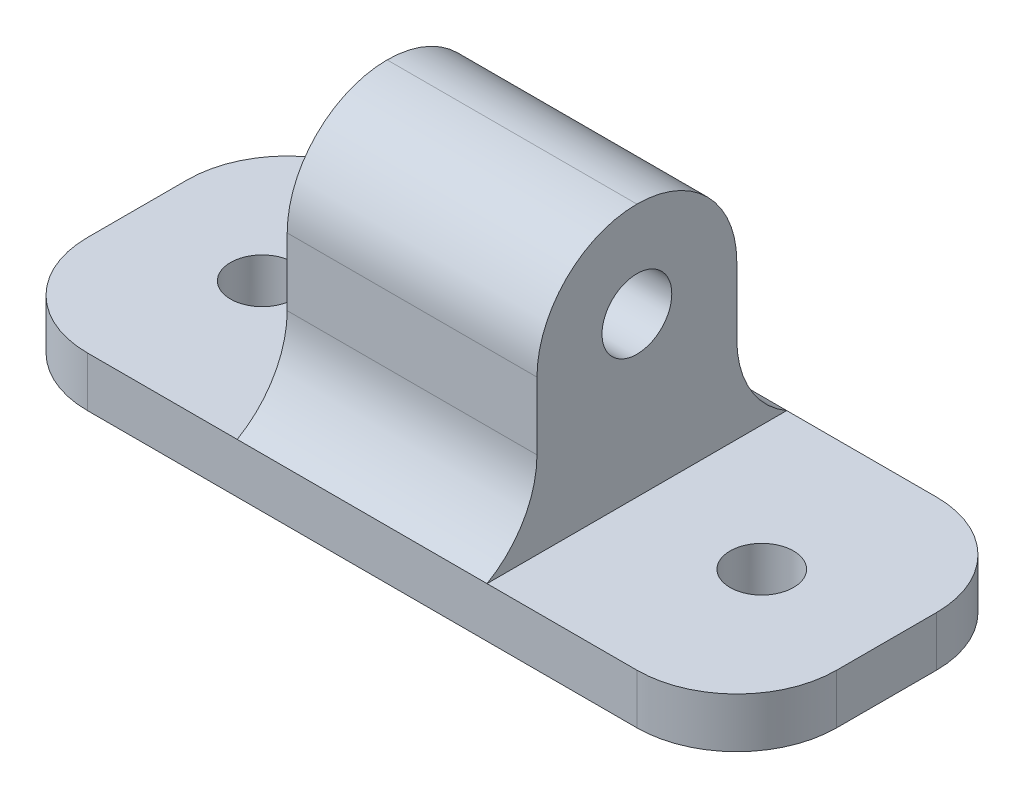
from build123d import *

# Parameters (mm, degrees)
SKETCH1_W                   = 75
SKETCH1_H                   = 30
BOSS_EXTRUDE1_DEPTH         = 5
SKETCH2_W                   = 25
SKETCH2_H                   = 20
BOSS_EXTRUDE3_DEPTH         = 25.4
SKETCH3_R                   = 3.4925
CUT_EXTRUDE1_DEPTH          = 61.408277578
F_1_4_0_25_DIAMETER_HOLE2_D = 6.35
FILLET2_R                   = 10


with BuildPart() as part:
    # Sketch1 → Boss-Extrude1 (new body)
    with BuildSketch(Plane(origin=(0, 0, 0), x_dir=(1, 0, 0), z_dir=(0, 1, 0))):
        Rectangle(SKETCH1_W, SKETCH1_H)
    extrude(amount=BOSS_EXTRUDE1_DEPTH)

    # Sketch2 → Boss-Extrude3 (add)
    with BuildSketch(Plane(origin=(0, 5, 0), x_dir=(1, 0, 0), z_dir=(0, 1, 0))):
        Rectangle(SKETCH2_W, SKETCH2_H)
    extrude(amount=BOSS_EXTRUDE3_DEPTH)

    # Sketch3 → Cut-Extrude1 (cut, through all)
    with BuildSketch(Plane(origin=(12.5, 0, 0), x_dir=(0, 0, -1), z_dir=(1, 0, 0))):
        with Locations((0, 20.875)):
            Circle(SKETCH3_R)
    extrude(amount=-CUT_EXTRUDE1_DEPTH, mode=Mode.SUBTRACT)

    # 1/4 (0.25) Diameter Hole2 (through all)
    with Locations(Plane(origin=(0, 5, 0), x_dir=(1, 0, 0), z_dir=(0, 1, 0))):
        with Locations((-25, 0), (25, 0)):
            Hole(F_1_4_0_25_DIAMETER_HOLE2_D / 2)

    # Fillet2
    # the kernel refuses this fillet: 10 mm, written as the material it adds along each edge
    with BuildSketch(Plane(origin=(-12.5, 5, 10), x_dir=(0, 0, 1), z_dir=(1, 0, 0)), Plane(origin=(12.5, 5, -10), x_dir=(0, 0, -1), z_dir=(-1, 0, 0))) as fillet2_piece_1:
        with BuildLine():
            CenterArc((10, -8.660254038), FILLET2_R, 120, 60)
            Line((0, -8.660254038), (0, 0))
            Line((0, 0), (5, 0))
        make_face()
    extrude(amount=25)
    # the kernel refuses this fillet: 10 mm, written as the material it takes off along each edge
    with BuildSketch(Plane(origin=(-37.5, -25, -15), x_dir=(1, 0, 0), z_dir=(0, 1, 0)), Plane(origin=(37.5, -25, 15), x_dir=(-1, 0, 0), z_dir=(0, 1, 0))) as fillet2_2_piece_1:
        with BuildLine():
            CenterArc((FILLET2_R, -FILLET2_R), FILLET2_R, 90, 90)
            Line((0, -FILLET2_R), (0, 0))
            Line((0, 0), (FILLET2_R, 0))
        make_face()
    extrude(amount=55, mode=Mode.SUBTRACT)
    with BuildSketch(Plane(origin=(-37.5, -25, 15), x_dir=(1, 0, 0), z_dir=(0, 1, 0)), Plane(origin=(37.5, -25, -15), x_dir=(-1, 0, 0), z_dir=(0, 1, 0))) as fillet2_2_piece_2:
        with BuildLine():
            CenterArc((FILLET2_R, FILLET2_R), FILLET2_R, 180, 90)
            Line((0, FILLET2_R), (0, 0))
            Line((0, 0), (FILLET2_R, 0))
        make_face()
    extrude(amount=55, mode=Mode.SUBTRACT)
    with BuildSketch(Plane(origin=(-37.5, 30.4, 10), x_dir=(0, 0, -1), z_dir=(1, 0, 0)), Plane(origin=(37.5, 30.4, -10), x_dir=(0, 0, 1), z_dir=(-1, 0, 0))) as fillet2_2_piece_3:
        with BuildLine():
            CenterArc((FILLET2_R, -FILLET2_R), FILLET2_R, 90, 90)
            Line((0, -FILLET2_R), (0, 0))
            Line((0, 0), (FILLET2_R, 0))
        make_face()
    extrude(amount=75, mode=Mode.SUBTRACT)


solid = part.part
